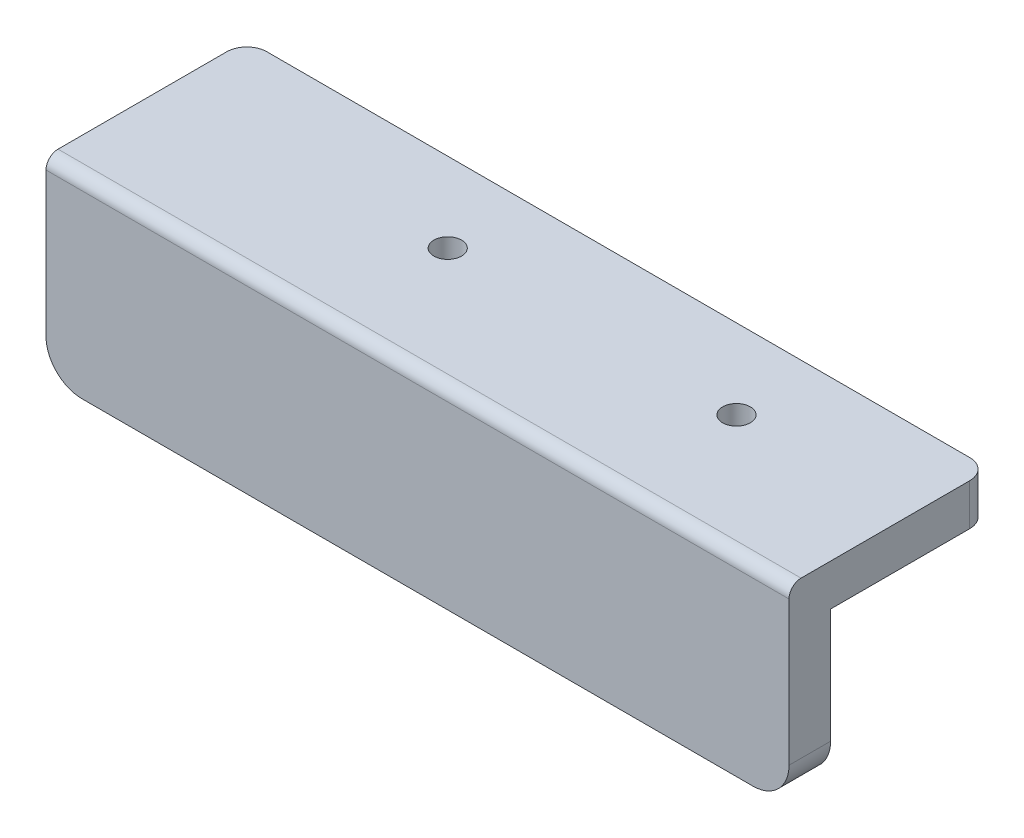
from build123d import *

# Parameters (mm, degrees)
SKETCH1_W           = 93.98
SKETCH1_H           = 19.05
BOSS_EXTRUDE1_DEPTH = 2.6289
SKETCH2_W           = 93.98
SKETCH2_H           = 25.4
BOSS_EXTRUDE2_DEPTH = 5.2578
FILLET6_R           = 4.572
FILLET7_R           = 4.572
FILLET8_R           = 1.524
FILLET9_R           = 2.54
FILLET10_R          = 2.54
CAVITY1_START       = 9.525
CAVITY1_OUTLINE_R   = 1.7526
CAVITY1_DEPTH       = 5.2578


# Read off the part's stored shape, not the designer's step: Cavity1
with BuildPart() as part:
    # Sketch1 → Boss-Extrude1 (new, symmetric)
    with BuildSketch(Plane.XY):
        Rectangle(SKETCH1_W, SKETCH1_H)
    extrude(amount=BOSS_EXTRUDE1_DEPTH, both=True)

    # Sketch2 → Boss-Extrude2 (add)
    with BuildSketch(Plane(origin=(0, 9.525, 0), x_dir=(1, 0, 0), z_dir=(0, 1, 0))):
        with Locations((0, 10.0711)):
            Rectangle(SKETCH2_W, SKETCH2_H)
    extrude(amount=BOSS_EXTRUDE2_DEPTH)

    # Fillet6
    fillet6_edges = [part.edges().sort_by_distance(p)[0] for p in [
        (-46.99, -9.525, 0),
    ]]
    fillet(fillet6_edges, radius=FILLET6_R)

    # Fillet7
    fillet7_edges = [part.edges().sort_by_distance(p)[0] for p in [
        (46.99, -9.525, 0),
    ]]
    fillet(fillet7_edges, radius=FILLET7_R)

    # Fillet8
    fillet8_edges = [part.edges().sort_by_distance(p)[0] for p in [
        (0, 14.7828, 2.6289),
    ]]
    fillet(fillet8_edges, radius=FILLET8_R)

    # Fillet9
    fillet9_edges = [part.edges().sort_by_distance(p)[0] for p in [
        (-46.99, 12.1539, -22.7711),
    ]]
    fillet(fillet9_edges, radius=FILLET9_R)

    # Fillet10
    fillet10_edges = [part.edges().sort_by_distance(p)[0] for p in [
        (46.99, 12.1539, -22.7711),
    ]]
    fillet(fillet10_edges, radius=FILLET10_R)

    # Cavity1 outline → Cavity1 (cut)
    with BuildSketch(Plane(origin=(0, 0, 0), x_dir=(1, 0, 0), z_dir=(0, 1, 0)).offset(CAVITY1_START)):
        with Locations((25.019, 12.7)):
            Circle(CAVITY1_OUTLINE_R)
        with Locations((-11.5062, 12.7)):
            Circle(CAVITY1_OUTLINE_R)
    extrude(amount=CAVITY1_DEPTH, mode=Mode.SUBTRACT)


solid = part.part
